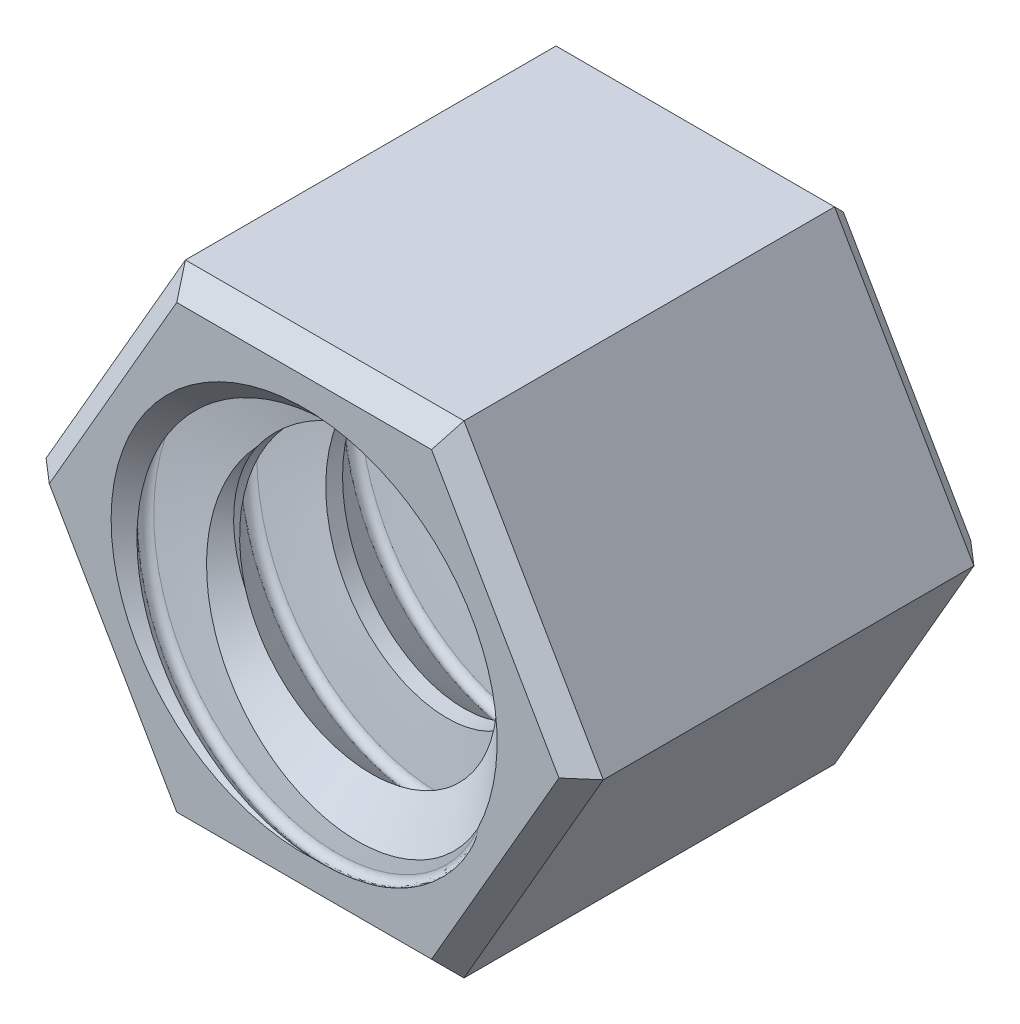
from build123d import *

# Parameters (mm, degrees)
SKETCH2_W           = 20.32
SKETCH2_H           = 25.4
BOSS_EXTRUDE1_DEPTH = 15.875
SKETCH3_R           = 6.5024
CUT_EXTRUDE1_DEPTH  = 29.743834556
CUT_SWEEP1_PITCH    = 5.08
SKETCH6_OUTSIDE_W   = 42.862
SKETCH6_OUTSIDE_H   = 36.512
CUT_EXTRUDE2_DEPTH  = 25.4
CHAMFER1_SIZE       = 1.016


with BuildPart() as part:
    # Sketch2 → Boss-Extrude1 (new, symmetric)
    with BuildSketch(Plane(origin=(0, 0, 0), x_dir=(0, 0, -1), z_dir=(1, 0, 0))):
        Rectangle(SKETCH2_W, SKETCH2_H)
    extrude(amount=BOSS_EXTRUDE1_DEPTH, both=True)

    # Sketch3 → Cut-Extrude1 (cut, through all)
    with BuildSketch(Plane.XY.offset(10.16)):
        Circle(SKETCH3_R)
    extrude(amount=-CUT_EXTRUDE1_DEPTH, mode=Mode.SUBTRACT)

    # Cut-Sweep1: the profile of Sketch5 profile screwed along a right-hand helix of 7 turns, 12 arcs to a turn; built about Z, then put on its axis
    cut_sweep1_z = Axis((0, 0, 0), (0, 0, 1))
    cut_sweep1_corners = [(6.5021, 0, -3.6835e-05), (9.550397395, 0, 0.374247022), (9.849144855, 0, 0.616167945), (9.762670037, 0, 0.990731536), (6.5021, 0, 4.251301573)]
    with BuildLine(mode=Mode.PRIVATE) as cut_sweep1_profile:
        Line(cut_sweep1_corners[0], cut_sweep1_corners[1])
        Line(cut_sweep1_corners[3], cut_sweep1_corners[4])
        Line(cut_sweep1_corners[4], cut_sweep1_corners[0])
        ThreePointArc((9.550397395, 0, 0.374247022), (9.734455979, 0, 0.452375256), (9.849144855, 0, 0.616167945))
        ThreePointArc((9.849144855, 0, 0.616167945), (9.859609637, 0, 0.815847868), (9.762670037, 0, 0.990731536))
    cut_sweep1_cap = Face(cut_sweep1_profile.wire())
    cut_sweep1_arcs = [((9.550397395, 0, 0.374247022), (9.77535561, 0, 0.401868417), (9.849144855, 0, 0.616167945), (1, 0.8480480961564262, 1)), ((9.849144855, 0, 0.616167945), (9.9229341, 0, 0.830467473), (9.762670037, 0, 0.990731536), (1, 0.8480480961564262, 1))]  # start, shoulder, end, weights
    cut_sweep1_turn_angles = [0, 15, 30, 45, 60, 75, 90, 105, 120, 135, 150, 165, 180, 195, 210, 225, 240, 255, 270, 285, 300, 315, 330, 345, 360]
    cut_sweep1_turn_weights = [1, 0.9659258262890683, 1, 0.9659258262890683, 1, 0.9659258262890683, 1, 0.9659258262890683, 1, 0.9659258262890683, 1, 0.9659258262890683, 1, 0.9659258262890683, 1, 0.9659258262890683, 1, 0.9659258262890683, 1, 0.9659258262890683, 1, 0.9659258262890683, 1, 0.9659258262890683, 1]
    cut_sweep1_turn_rails = [Edge.make_bspline([Vector(p[0], p[1], 0).rotate(cut_sweep1_z, cut_sweep1_turn_angles[k]) / cut_sweep1_turn_weights[k] + Vector(0, 0, p[2] + CUT_SWEEP1_PITCH * cut_sweep1_turn_angles[k] / 360) for k in range(25)], [0, 0, 0, 1, 1, 2, 2, 3, 3, 4, 4, 5, 5, 6, 6, 7, 7, 8, 8, 9, 9, 10, 10, 11, 11, 12, 12, 12], 2, cut_sweep1_turn_weights) for p in cut_sweep1_corners]
    cut_sweep1_turn_sides = [*[Face.make_surface_from_curves(cut_sweep1_turn_rails[p[0]], cut_sweep1_turn_rails[p[1]]) for p in [(0, 1), (3, 4), (4, 0)]], *[Face.make_bezier_surface([[Vector(p[j][0], p[j][1], 0).rotate(cut_sweep1_z, cut_sweep1_turn_angles[2 * i + k]) / cut_sweep1_turn_weights[2 * i + k] + Vector(0, 0, p[j][2] + CUT_SWEEP1_PITCH * cut_sweep1_turn_angles[2 * i + k] / 360) for k in range(3)] for j in range(3)], [[p[3][j] * cut_sweep1_turn_weights[2 * i + k] for k in range(3)] for j in range(3)]) for p in cut_sweep1_arcs for i in range(12)]]
    cut_sweep1 = Plane(origin=(0, 0, -15.24), x_dir=(1, 0, 0), z_dir=(0, 0, 1)) * Solid(Shell([*[p.moved(Location((0, 0, CUT_SWEEP1_PITCH * i))) for i in range(7) for p in cut_sweep1_turn_sides], cut_sweep1_cap, cut_sweep1_cap.rotate(cut_sweep1_z, 2520).moved(Location((0, 0, CUT_SWEEP1_PITCH * 2520 / 360)))]))
    add(cut_sweep1, mode=Mode.SUBTRACT)

    # Sketch6 outside → Cut-Extrude2 (cut, symmetric)
    with BuildSketch(Plane.XY):
        Rectangle(SKETCH6_OUTSIDE_W, SKETCH6_OUTSIDE_H)
        Polygon((13.748153285, 0), (6.874076643, 11.90625), (-6.874076643, 11.90625), (-13.748153285, 0), (-6.874076643, -11.90625), (6.874076643, -11.90625), align=None, mode=Mode.SUBTRACT)
    extrude(amount=CUT_EXTRUDE2_DEPTH, both=True, mode=Mode.SUBTRACT)

    # Sketch7 → Cut-Revolve1 (revolve, cut)
    with BuildSketch(Plane(origin=(0, 0, 0), x_dir=(1, 0, 0), z_dir=(0, 1, 0))):
        Polygon((0, -10.16), (9.525, -10.16), (0, -0.635), align=None)
        Polygon((0, 10.16), (0, 0.635), (9.525, 10.16), align=None)
    revolve(axis=Axis((0, 0, 1000), (0, 0, -1)), mode=Mode.SUBTRACT)

    # Chamfer1
    chamfer1_edges = [part.edges().sort_by_distance(p)[0] for p in [
        (10.311114964, 5.953125, 10.16),
        (0, 11.90625, 10.16),
        (-10.311114964, 5.953125, 10.16),
        (-10.311114964, -5.953125, 10.16),
        (0, -11.90625, 10.16),
        (10.311114964, -5.953125, 10.16),
        (10.311114964, -5.953125, -10.16),
        (0, -11.90625, -10.16),
        (-10.311114964, -5.953125, -10.16),
        (-10.311114964, 5.953125, -10.16),
        (0, 11.90625, -10.16),
        (10.311114964, 5.953125, -10.16),
    ]]
    chamfer(chamfer1_edges, length=CHAMFER1_SIZE)


solid = part.part
